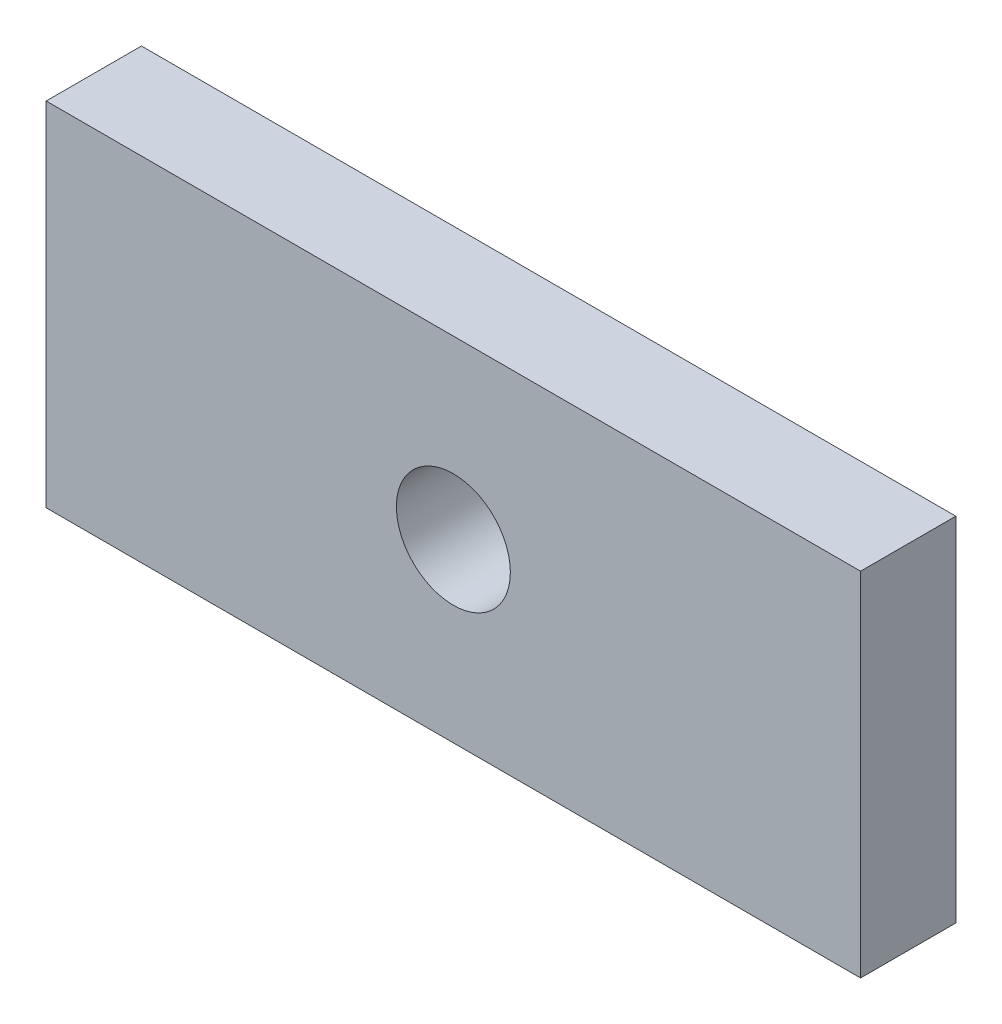
from build123d import *

# Parameters (mm, degrees)
SKETCH1_W           = 36.988537316
SKETCH1_H           = 85.498094454
BOSS_EXTRUDE1_DEPTH = 10
SKETCH2_R           = 5.981248703
CUT_EXTRUDE1_DEPTH  = 10


with BuildPart() as part:
    # Sketch1 → Boss-Extrude1 (new body)
    with BuildSketch(Plane(origin=(0, 0, 0), x_dir=(0, 1, 0), z_dir=(0, 0, 1))):
        Rectangle(SKETCH1_W, SKETCH1_H)
    extrude(amount=BOSS_EXTRUDE1_DEPTH)

    # Sketch2 → Cut-Extrude1 (cut)
    with BuildSketch(Plane.XY.offset(10)):
        Circle(SKETCH2_R)
    extrude(amount=-CUT_EXTRUDE1_DEPTH, mode=Mode.SUBTRACT)


solid = part.part
